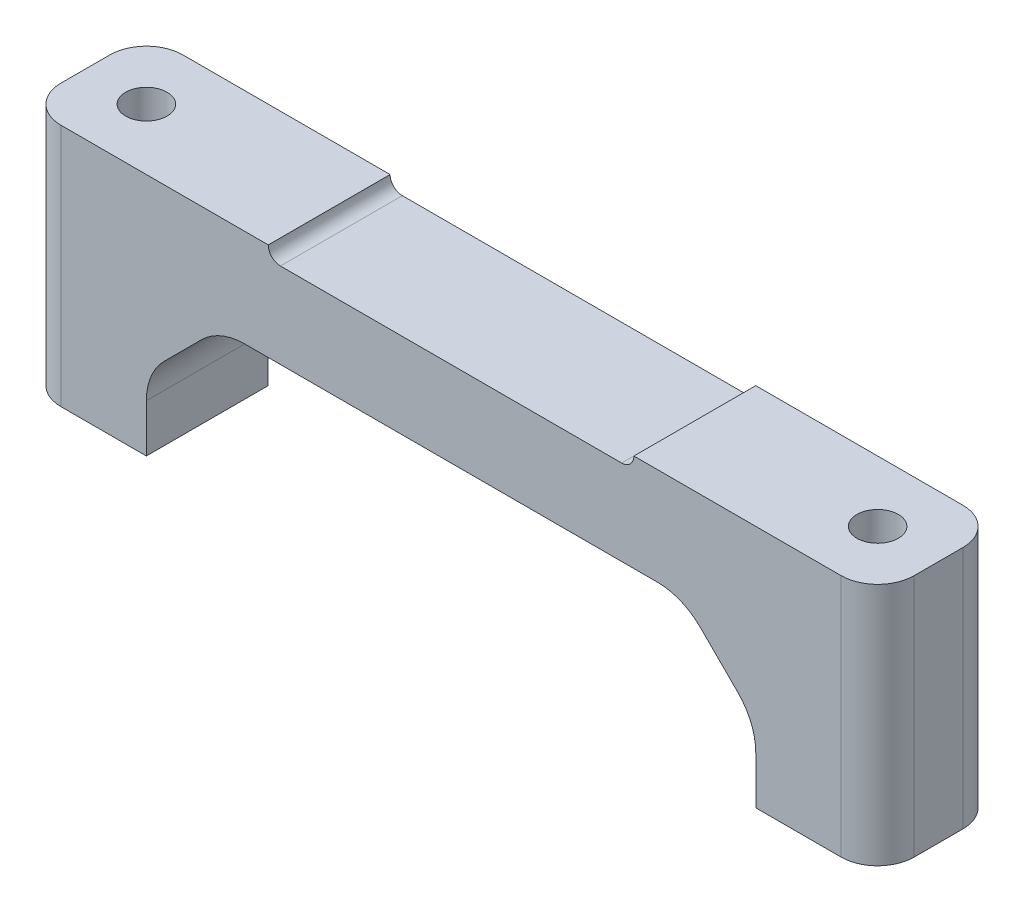
from build123d import *

# Parameters (mm, degrees)
SKETCH_1_W          = 70
SKETCH_1_H          = 10
EXTRUDE_1_DEPTH     = 20
SKETCH_2_R          = 1.7
CUT_EXTRUDE_1_DEPTH = 20
SKETCH_3_W          = 30
SKETCH_3_H          = 1
CUT_EXTRUDE_2_DEPTH = 10
FILLET_1_R          = 5
FILLET_2_R          = 3
FILLET_3_R          = 1


with BuildPart() as part:
    # 草图1 → 凸台-拉伸1 (new body)
    with BuildSketch(Plane(origin=(0, 0, 0), x_dir=(1, 0, 0), z_dir=(0, 1, 0))):
        Rectangle(SKETCH_1_W, SKETCH_1_H)
    extrude(amount=EXTRUDE_1_DEPTH)

    # 草图2 → 切除-拉伸1 (cut)
    with BuildSketch(Plane(origin=(0, 20, 0), x_dir=(1, 0, 0), z_dir=(0, 1, 0))):
        with Locations(Location((-30, 0, 0), (0, 0, 270))):
            Circle(SKETCH_2_R)
        with Locations(Location((30, 0, 0), (0, 0, 90))):
            Circle(SKETCH_2_R)
    extrude(amount=-CUT_EXTRUDE_1_DEPTH, mode=Mode.SUBTRACT)

    # 草图3 → 切除-拉伸2 (cut)
    with BuildSketch(Plane.XY.offset(5)):
        Polygon((-25, 0), (25, 0), (25, 6), (19, 12), (-19, 12), (-25, 6), align=None)
        with Locations((0, 19.5)):
            Rectangle(SKETCH_3_W, SKETCH_3_H)
    extrude(amount=-CUT_EXTRUDE_2_DEPTH, mode=Mode.SUBTRACT)

    # 圆角1
    fillet_1_edges = [part.edges().sort_by_distance(p)[0] for p in [
        (-25, 6, 0),
        (-19, 12, 0),
        (19, 12, 0),
        (25, 6, 0),
    ]]
    fillet(fillet_1_edges, radius=FILLET_1_R)

    # 圆角2
    fillet_2_edges = [part.edges().sort_by_distance(p)[0] for p in [
        (35, 10, 5),
        (-35, 10, 5),
        (-35, 10, -5),
        (35, 10, -5),
    ]]
    fillet(fillet_2_edges, radius=FILLET_2_R)

    # 圆角3
    fillet_3_edges = [part.edges().sort_by_distance(p)[0] for p in [
        (15, 19, 0),
        (-15, 19, 0),
    ]]
    fillet(fillet_3_edges, radius=FILLET_3_R - 0.0001)  # a hair under: the kernel refuses the full size


solid = part.part
